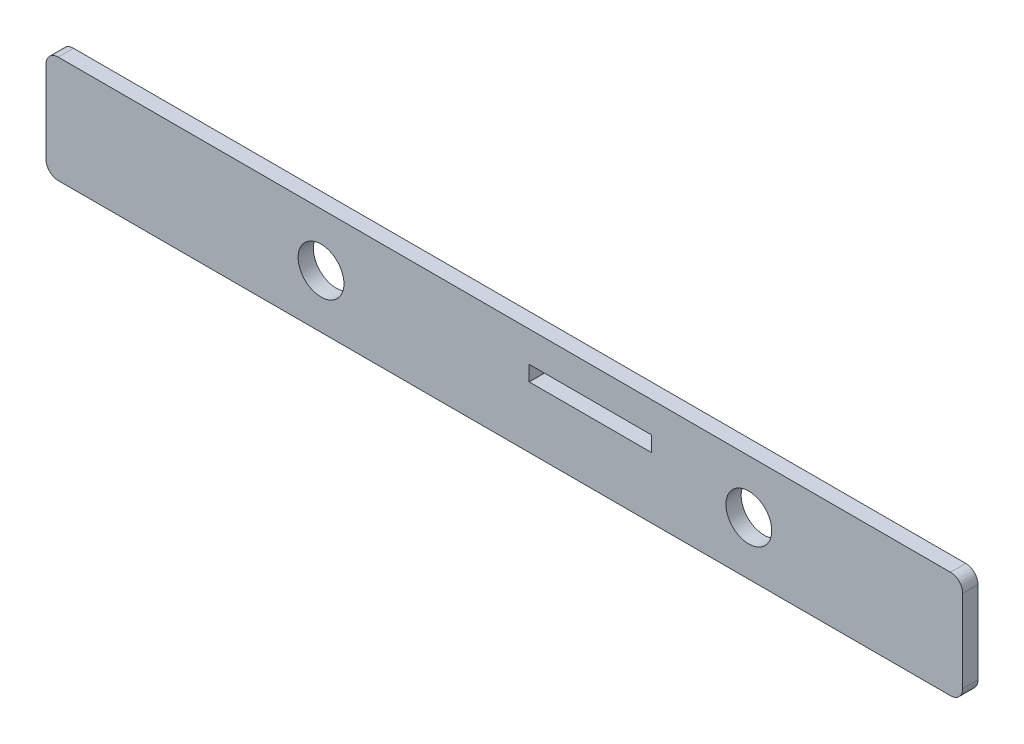
from build123d import *

# Parameters (mm, degrees)
SKETCH1_W           = 381
SKETCH1_H           = 44.45
SKETCH1_R           = 9.525
BOSS_EXTRUDE1_DEPTH = 6.35
FILLET1_R           = 5.08
SKETCH2_W           = 50.8
SKETCH2_H           = 6.35
CUT_EXTRUDE1_DEPTH  = 1488.706887503


with BuildPart() as part:
    # Sketch1 → Boss-Extrude1 (new body)
    with BuildSketch(Plane.XY):
        with Locations((1295.4, -50.8)):
            Rectangle(SKETCH1_W, SKETCH1_H)
        with Locations((1219.2, -50.8)):
            Circle(SKETCH1_R, mode=Mode.SUBTRACT)
        with Locations((1397, -50.8)):
            Circle(SKETCH1_R, mode=Mode.SUBTRACT)
    extrude(amount=BOSS_EXTRUDE1_DEPTH)

    # Fillet1
    fillet1_edges = [part.edges().sort_by_distance(p)[0] for p in [
        (1485.9, -73.025, 3.175),
        (1485.9, -28.575, 3.175),
        (1104.9, -73.025, 3.175),
        (1104.9, -28.575, 3.175),
    ]]
    fillet(fillet1_edges, radius=FILLET1_R)

    # Sketch2 → Cut-Extrude1 (cut, through all)
    with BuildSketch(Plane.XY.offset(6.35)):
        with Locations((1331.11875, -44.45)):
            Rectangle(SKETCH2_W, SKETCH2_H)
    extrude(amount=-CUT_EXTRUDE1_DEPTH, mode=Mode.SUBTRACT)


solid = part.part
